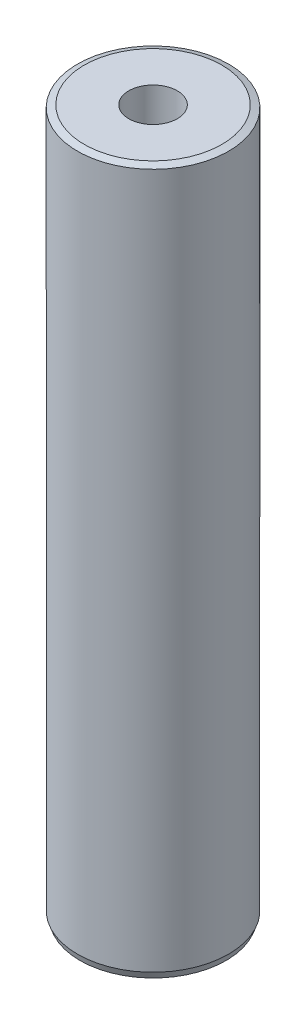
from build123d import *
from OCP.BRepFilletAPI import BRepFilletAPI_MakeChamfer

# Parameters (mm, degrees)
SKETCH1_R           = 47.5
BOSS_EXTRUDE1_DEPTH = 442.97553083
SKETCH2_R           = 15.253938162
CUT_EXTRUDE1_DEPTH  = 449.039976915
CHAMFER1_SIZE       = 1.56208035
CHAMFER1_SIZE2      = 4.254078938


with BuildPart() as part:
    # Sketch1 → Boss-Extrude1 (new body)
    with BuildSketch(Plane(origin=(0, 0, 0), x_dir=(1, 0, 0), z_dir=(0, 1, 0))):
        Circle(SKETCH1_R)
    extrude(amount=BOSS_EXTRUDE1_DEPTH)

    # Sketch2 → Cut-Extrude1 (cut, through all)
    with BuildSketch(Plane(origin=(0, 0, 0), x_dir=(1, 0, 0), z_dir=(0, 1, 0))):
        Circle(SKETCH2_R)
    extrude(amount=CUT_EXTRUDE1_DEPTH, mode=Mode.SUBTRACT)

    # Chamfer1: one chamfer whose edges measure the first distance from different faces: ONE call of the kernel's chamfer builder (chamfer() names one face for all edges)
    chamfer1_edges_1 = [part.edges().sort_by_distance(p)[0] for p in [
        (-47.5, 442.97553083, 0),
    ]]
    chamfer1_side_1 = [part.faces().sort_by_distance(p)[0] for p in [
        (-47.5, 221.487765415, 0),
    ]]
    chamfer1_edges_2 = [part.edges().sort_by_distance(p)[0] for p in [
        (-47.5, 0, 0),
    ]]
    chamfer1_side_2 = [part.faces().sort_by_distance(p)[0] for p in [
        (-46.156497116, 0, 0),
    ]]
    chamfer1 = BRepFilletAPI_MakeChamfer(part.part.solid().wrapped)
    for e in chamfer1_edges_1:
        chamfer1.Add(CHAMFER1_SIZE, CHAMFER1_SIZE2, e.wrapped, chamfer1_side_1[0].wrapped)  # the first distance lies on this face
    for e in chamfer1_edges_2:
        chamfer1.Add(CHAMFER1_SIZE, CHAMFER1_SIZE2, e.wrapped, chamfer1_side_2[0].wrapped)  # the first distance lies on this face
    add(Compound.cast(chamfer1.Shape()), mode=Mode.REPLACE)


solid = part.part
